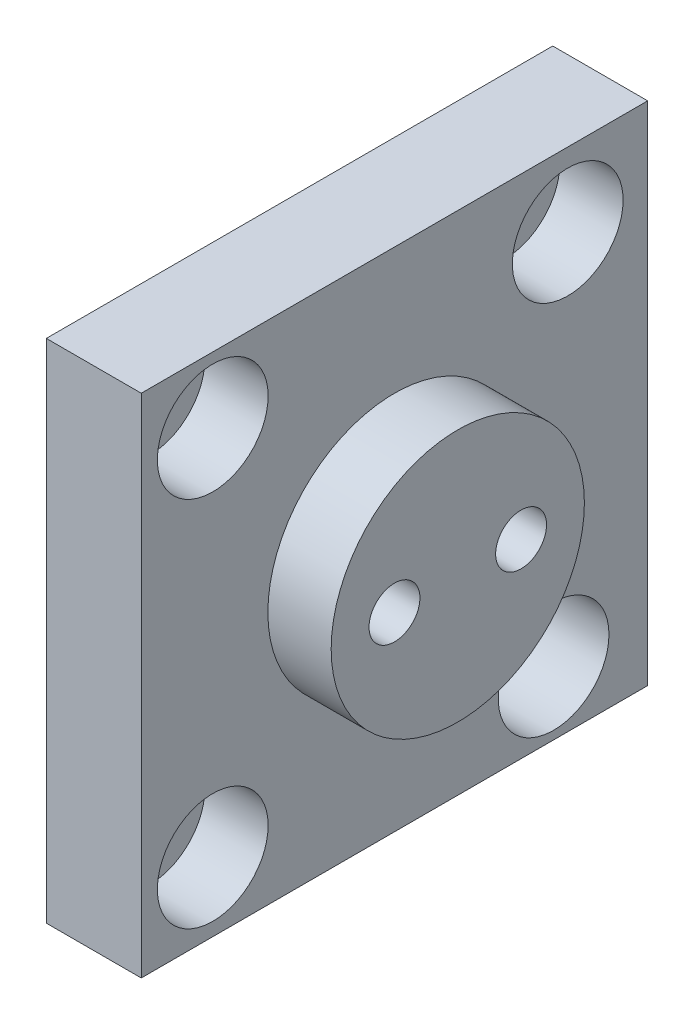
from build123d import *

# Parameters (mm, degrees)
SKETCH1_W                                        = 50.8
SKETCH1_H                                        = 50.8
BOSS_EXTRUDE1_DEPTH                              = 9.525
SKETCH2_R                                        = 12.7
BOSS_EXTRUDE2_DEPTH                              = 6.35
F_1_4_20_TAPPED_HOLE1_D                          = 5.1054
CBORE_FOR_1_4_SOCKET_HEAD_CAP_SCREW1_D           = 6.7564
CBORE_FOR_1_4_SOCKET_HEAD_CAP_SCREW1_CBORE_D     = 11.1125
CBORE_FOR_1_4_SOCKET_HEAD_CAP_SCREW1_CBORE_DEPTH = 6.35


with BuildPart() as part:
    # Sketch1 → Boss-Extrude1 (new body)
    with BuildSketch(Plane(origin=(0, 0, 0), x_dir=(0, 0, -1), z_dir=(1, 0, 0))):
        Rectangle(SKETCH1_W, SKETCH1_H)
    extrude(amount=BOSS_EXTRUDE1_DEPTH)

    # Sketch2 → Boss-Extrude2 (add)
    with BuildSketch(Plane(origin=(9.525, 0, 0), x_dir=(0, 0, -1), z_dir=(1, 0, 0))):
        Circle(SKETCH2_R)
    extrude(amount=BOSS_EXTRUDE2_DEPTH)

    # 1/4-20 Tapped Hole1 (through all)
    with Locations(Plane(origin=(15.875, 0, 0), x_dir=(0, 0, -1), z_dir=(1, 0, 0))):
        with Locations((-6.35, 0), (6.35, 0)):
            Hole(F_1_4_20_TAPPED_HOLE1_D / 2)

    # CBORE for 1/4 Socket Head Cap Screw1 (through all)
    with Locations(Plane(origin=(9.525, 0, 0), x_dir=(0, 0, -1), z_dir=(1, 0, 0))):
        with Locations((-18.22919312, 18.79663882), (17.378024569, 18.016400982), (15.959410319, -19.009430957), (-18.22919312, -18.51291597)):
            CounterBoreHole(CBORE_FOR_1_4_SOCKET_HEAD_CAP_SCREW1_D / 2, CBORE_FOR_1_4_SOCKET_HEAD_CAP_SCREW1_CBORE_D / 2, CBORE_FOR_1_4_SOCKET_HEAD_CAP_SCREW1_CBORE_DEPTH)


solid = part.part
